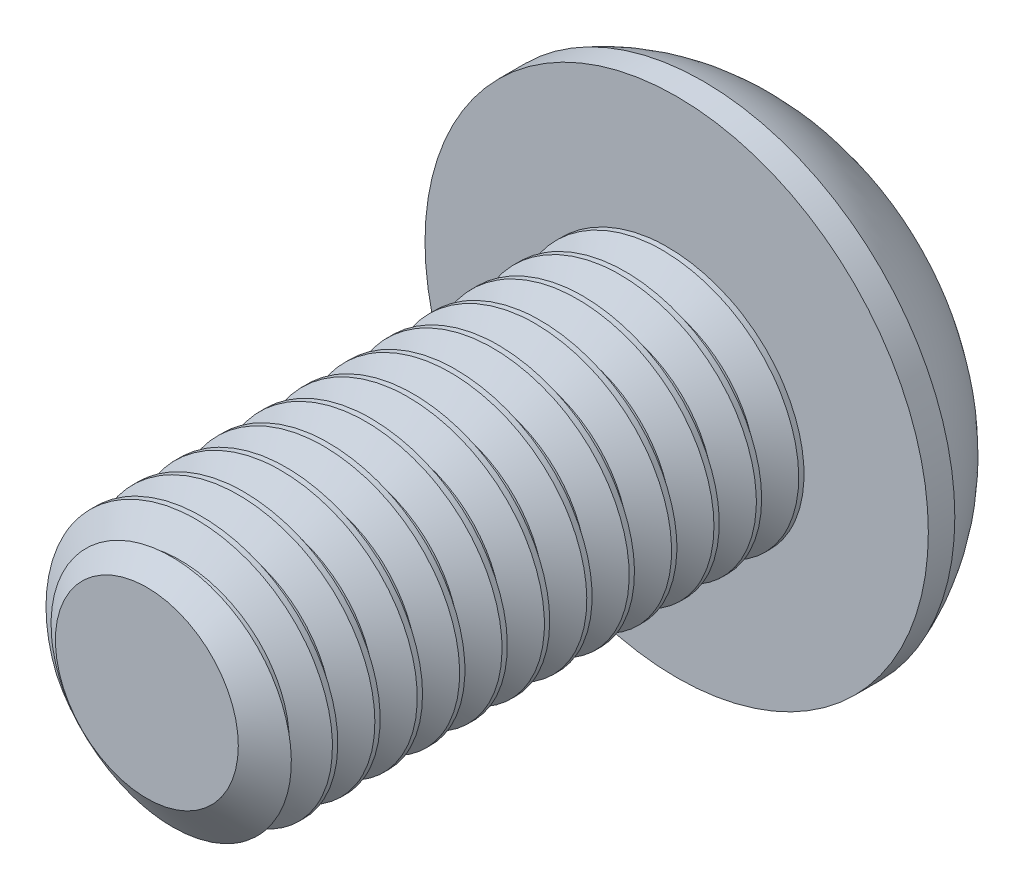
from build123d import *

# Parameters (mm, degrees)
SKETCH1_R          = 2.5
EXTRUDE1_DEPTH     = 10
CUT_SWEEP1_PITCH   = 0.799999999999994
SKETCH6_R          = 4.75
EXTRUDE2_DEPTH     = 2.75
CUT_EXTRUDE1_DEPTH = 2.25
SKETCH8_R          = 1.7320508075688774
CUT_EXTRUDE2_DEPTH = 15.411367195724354
CUT_EXTRUDE2_TAPER = 45.0000000000001


with BuildPart() as part:
    # Sketch1 → Extrude1 (new body)
    with BuildSketch(Plane.XY):
        Circle(SKETCH1_R)
    extrude(amount=-EXTRUDE1_DEPTH)

    # Cut-Sweep1: the profile of Sketch3 profile screwed along a right-hand helix of 13.5 turns, 6 arcs to a turn; built about Z, then put on its axis
    cut_sweep1_z = Axis((0, 0, 0), (0, 0, 1))
    cut_sweep1_corners = [(2.5003, 0, -0.700173205), (1.980384758, 0, -0.4), (1.980384758, 0, -0.3), (2.5003, 0, 0.000173205)]
    with BuildLine(mode=Mode.PRIVATE) as cut_sweep1_profile:
        Line(cut_sweep1_corners[0], cut_sweep1_corners[1])
        Line(cut_sweep1_corners[1], cut_sweep1_corners[2])
        Line(cut_sweep1_corners[2], cut_sweep1_corners[3])
        Line(cut_sweep1_corners[3], cut_sweep1_corners[0])
    cut_sweep1_cap = Face(cut_sweep1_profile.wire())
    cut_sweep1_turn_angles = [0, 30, 60, 90, 120, 150, 180, 210, 240, 270, 300, 330, 360]
    cut_sweep1_turn_weights = [1, 0.8660254037844387, 1, 0.8660254037844387, 1, 0.8660254037844387, 1, 0.8660254037844387, 1, 0.8660254037844387, 1, 0.8660254037844387, 1]
    cut_sweep1_turn_rails = [Edge.make_bspline([Vector(p[0], p[1], 0).rotate(cut_sweep1_z, cut_sweep1_turn_angles[k]) / cut_sweep1_turn_weights[k] + Vector(0, 0, p[2] + CUT_SWEEP1_PITCH * cut_sweep1_turn_angles[k] / 360) for k in range(13)], [0, 0, 0, 1, 1, 2, 2, 3, 3, 4, 4, 5, 5, 6, 6, 6], 2, cut_sweep1_turn_weights) for p in cut_sweep1_corners]
    cut_sweep1_turn_sides = [Face.make_surface_from_curves(cut_sweep1_turn_rails[p[0]], cut_sweep1_turn_rails[p[1]]) for p in [(0, 1), (1, 2), (2, 3), (3, 0)]]
    cut_sweep1_last_angles = [4680, 4710, 4740, 4770, 4800, 4830, 4860]
    cut_sweep1_last_weights = [1, 0.8660254037844387, 1, 0.8660254037844387, 1, 0.8660254037843553, 1]
    cut_sweep1_last_rails = [Edge.make_bspline([Vector(p[0], p[1], 0).rotate(cut_sweep1_z, cut_sweep1_last_angles[k]) / cut_sweep1_last_weights[k] + Vector(0, 0, p[2] + CUT_SWEEP1_PITCH * cut_sweep1_last_angles[k] / 360) for k in range(7)], [0, 0, 0, 1, 1, 2, 2, 3, 3, 3], 2, cut_sweep1_last_weights) for p in cut_sweep1_corners]
    cut_sweep1_last_sides = [Face.make_surface_from_curves(cut_sweep1_last_rails[p[0]], cut_sweep1_last_rails[p[1]]) for p in [(0, 1), (1, 2), (2, 3), (3, 0)]]
    cut_sweep1 = Plane(origin=(0, 0, 0), x_dir=(-3.49e-15, 1, 0), z_dir=(0, 0, -1)) * Solid(Shell([*[p.moved(Location((0, 0, CUT_SWEEP1_PITCH * i))) for i in range(13) for p in cut_sweep1_turn_sides], *cut_sweep1_last_sides, cut_sweep1_cap, cut_sweep1_cap.rotate(cut_sweep1_z, 4860).moved(Location((0, 0, CUT_SWEEP1_PITCH * 4860 / 360)))]))
    add(cut_sweep1, mode=Mode.SUBTRACT)

    # Sketch4 → Cut-Revolve1 (revolve, cut)
    with BuildSketch(Plane(origin=(0, 0, 0), x_dir=(0, 0, -1), z_dir=(1, 0, 0)), mode=Mode.PRIVATE) as cut_revolve1_sk:
        Polygon((0.5416912243118476, 2.5), (0, 1.7263847577293348), (0, 2.5), align=None)
    revolve(cut_revolve1_sk.sketch.rotate(Axis((0, 0, 0), (0, 0, -1)), 260.43858876), axis=Axis((0, 0, 0), (0, 0, -1)), mode=Mode.SUBTRACT)

    # Sketch6 → Extrude2 (add)
    with BuildSketch(Plane(origin=(0, 0, -10), x_dir=(-1, 0, 0), z_dir=(0, 0, -1))):
        Circle(SKETCH6_R)
    extrude(amount=EXTRUDE2_DEPTH)

    # Sketch10 → Cut-Revolve2 (revolve, cut)
    with BuildSketch(Plane(origin=(0, 0, 0), x_dir=(0, 0, -1), z_dir=(1, 0, 0)), mode=Mode.PRIVATE) as cut_revolve2_sk:
        with BuildLine():
            Line((10.5, 4.75), (10.500000000000002, 5.25))
            Line((10.500000000000002, 5.25), (13.250000000000002, 5.25))
            Line((13.250000000000002, 5.25), (13.250000000000002, 1.5000000000000004))
            Line((13.250000000000002, 1.5000000000000004), (12.750000000000002, 1.5000000000000004))
            ThreePointArc((12.750000000000002, 1.5000000000000004), (12.132611776540898, 3.476423537605238), (10.5, 4.75))
        make_face()
    revolve(cut_revolve2_sk.sketch.rotate(Axis((0, 0, 0), (0, 0, -1)), 90), axis=Axis((0, 0, 0), (0, 0, -1)), mode=Mode.SUBTRACT)

    # Sketch7 → Cut-Extrude1 (cut)
    with BuildSketch(Plane(origin=(0, 0, -12.750000000000002), x_dir=(-1, 0, 0), z_dir=(0, 0, -1))):
        Polygon((-2.6e-16, 1.7320508075688774), (-1.5, 0.8660254037844389), (-1.5, -0.8660254037844387), (1e-16, -1.7320508075688774), (1.5000000000000009, -0.8660254037844387), (1.5000000000000002, 0.8660254037844387), align=None)
    extrude(amount=-CUT_EXTRUDE1_DEPTH, mode=Mode.SUBTRACT)

    # Sketch8 → Cut-Extrude2 (cut, through all)
    with BuildSketch(Plane.XY.offset(-12.750000000000002)):
        Circle(SKETCH8_R)
    extrude(amount=CUT_EXTRUDE2_DEPTH, taper=CUT_EXTRUDE2_TAPER, mode=Mode.SUBTRACT)


solid = part.part
